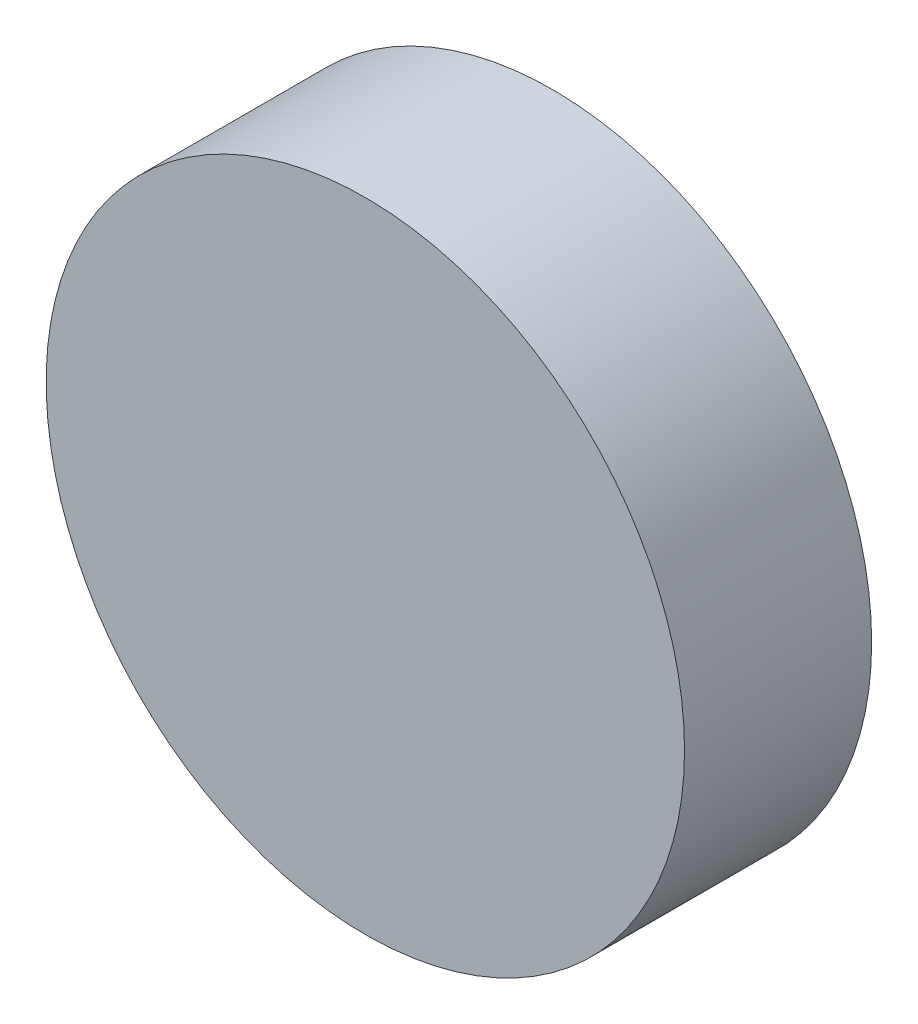
from build123d import *

# Parameters (mm, degrees)
SKETCH1_R           = 36.83
BOSS_EXTRUDE2_DEPTH = 21.59


with BuildPart() as part:
    # Sketch1 → Boss-Extrude2 (new body)
    with BuildSketch(Plane.XY):
        Circle(SKETCH1_R)
    extrude(amount=BOSS_EXTRUDE2_DEPTH)


solid = part.part
